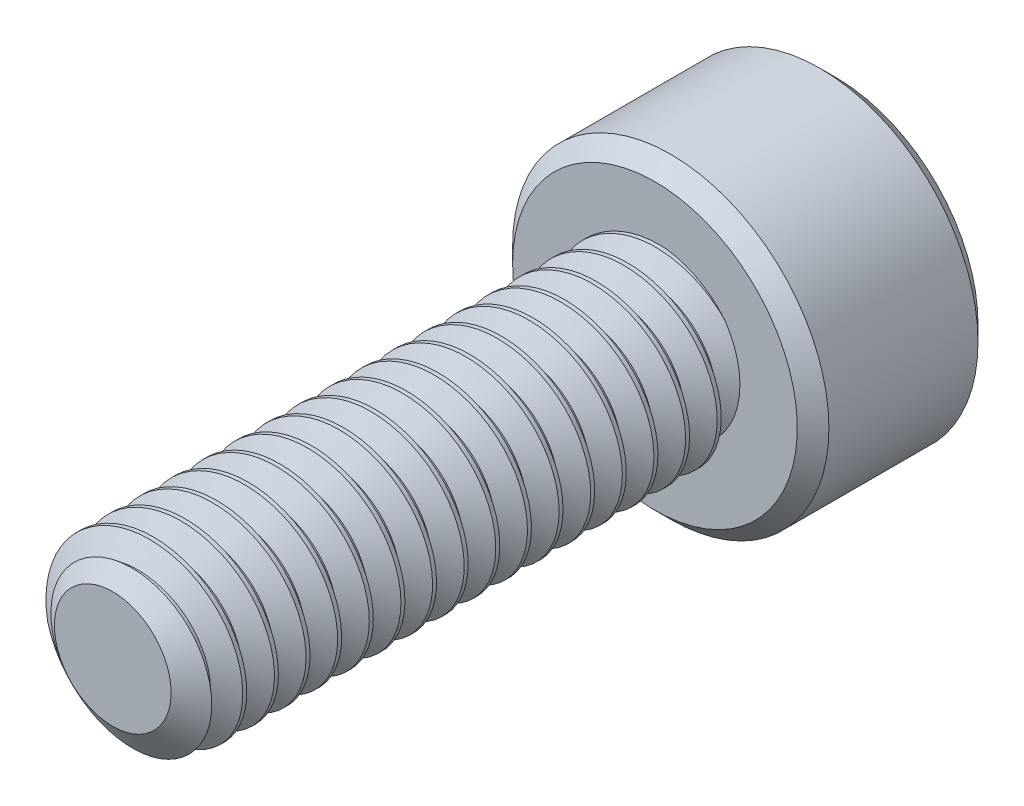
from build123d import *

# Parameters (mm, degrees)
SKETCH1_R          = 2
EXTRUDE1_DEPTH     = 12
CUT_SWEEP1_PITCH   = 0.7
SKETCH6_R          = 3.5
EXTRUDE2_DEPTH     = 4
CUT_EXTRUDE1_DEPTH = 2.25
CHAMFER1_SIZE      = 0.35


with BuildPart() as part:
    # Sketch1 → Extrude1 (new body)
    with BuildSketch(Plane.XY):
        Circle(SKETCH1_R)
    extrude(amount=-EXTRUDE1_DEPTH)

    # Cut-Sweep1: the profile of Sketch3 profile screwed along a right-hand helix of 18.142857 turns, 6 arcs to a turn; built about Z, then put on its axis
    cut_sweep1_z = Axis((0, 0, 0), (0, 0, 1))
    cut_sweep1_corners = [(2.0003, 0, -0.612673205), (1.545336663, 0, -0.35), (1.545336663, 0, -0.2625), (2.0003, 0, 0.000173205)]
    with BuildLine(mode=Mode.PRIVATE) as cut_sweep1_profile:
        Line(cut_sweep1_corners[0], cut_sweep1_corners[1])
        Line(cut_sweep1_corners[1], cut_sweep1_corners[2])
        Line(cut_sweep1_corners[2], cut_sweep1_corners[3])
        Line(cut_sweep1_corners[3], cut_sweep1_corners[0])
    cut_sweep1_cap = Face(cut_sweep1_profile.wire())
    cut_sweep1_turn_angles = [0, 30, 60, 90, 120, 150, 180, 210, 240, 270, 300, 330, 360]
    cut_sweep1_turn_weights = [1, 0.8660254037844387, 1, 0.8660254037844387, 1, 0.8660254037844387, 1, 0.8660254037844387, 1, 0.8660254037844387, 1, 0.8660254037844387, 1]
    cut_sweep1_turn_rails = [Edge.make_bspline([Vector(p[0], p[1], 0).rotate(cut_sweep1_z, cut_sweep1_turn_angles[k]) / cut_sweep1_turn_weights[k] + Vector(0, 0, p[2] + CUT_SWEEP1_PITCH * cut_sweep1_turn_angles[k] / 360) for k in range(13)], [0, 0, 0, 1, 1, 2, 2, 3, 3, 4, 4, 5, 5, 6, 6, 6], 2, cut_sweep1_turn_weights) for p in cut_sweep1_corners]
    cut_sweep1_turn_sides = [Face.make_surface_from_curves(cut_sweep1_turn_rails[p[0]], cut_sweep1_turn_rails[p[1]]) for p in [(0, 1), (1, 2), (2, 3), (3, 0)]]
    cut_sweep1_last_angles = [6480, 6505.714285714, 6531.428571429]
    cut_sweep1_last_weights = [1, 0.9009688679026391, 1]
    cut_sweep1_last_rails = [Edge.make_bspline([Vector(p[0], p[1], 0).rotate(cut_sweep1_z, cut_sweep1_last_angles[k]) / cut_sweep1_last_weights[k] + Vector(0, 0, p[2] + CUT_SWEEP1_PITCH * cut_sweep1_last_angles[k] / 360) for k in range(3)], [0, 0, 0, 1, 1, 1], 2, cut_sweep1_last_weights) for p in cut_sweep1_corners]
    cut_sweep1_last_sides = [Face.make_surface_from_curves(cut_sweep1_last_rails[p[0]], cut_sweep1_last_rails[p[1]]) for p in [(0, 1), (1, 2), (2, 3), (3, 0)]]
    cut_sweep1 = Plane(origin=(0, 0, 0), x_dir=(0, 1, 0), z_dir=(0, 0, -1)) * Solid(Shell([*[p.moved(Location((0, 0, CUT_SWEEP1_PITCH * i))) for i in range(18) for p in cut_sweep1_turn_sides], *cut_sweep1_last_sides, cut_sweep1_cap, cut_sweep1_cap.rotate(cut_sweep1_z, 6531.428571429).moved(Location((0, 0, CUT_SWEEP1_PITCH * 6531.428571429 / 360)))]))
    add(cut_sweep1, mode=Mode.SUBTRACT)

    # Sketch4 → Cut-Revolve1 (revolve, cut)
    with BuildSketch(Plane(origin=(0, 0, 0), x_dir=(0, 0, -1), z_dir=(1, 0, 0)), mode=Mode.PRIVATE) as cut_revolve1_sk:
        Polygon((0.496211411, 2), (0, 1.291336663), (0, 2), align=None)
    revolve(cut_revolve1_sk.sketch.rotate(Axis((0, 0, 0), (0, 0, -1)), 271.401126896), axis=Axis((0, 0, 0), (0, 0, -1)), mode=Mode.SUBTRACT)

    # Sketch6 → Extrude2 (add)
    with BuildSketch(Plane(origin=(0, 0, -12), x_dir=(-1, 0, 0), z_dir=(0, 0, -1))):
        Circle(SKETCH6_R)
    extrude(amount=EXTRUDE2_DEPTH)

    # Sketch7 → Cut-Extrude1 (cut)
    with BuildSketch(Plane(origin=(0, 0, -16), x_dir=(-1, 0, 0), z_dir=(0, 0, -1))):
        Polygon((0, 1.732050808), (-1.5, 0.866025404), (-1.5, -0.866025404), (0, -1.732050808), (1.5, -0.866025404), (1.5, 0.866025404), align=None)
    extrude(amount=-CUT_EXTRUDE1_DEPTH, mode=Mode.SUBTRACT)

    # Cut-Extrude2 cone 1 section (through the dimple's axis) → Cut-Extrude2 (revolve, cut)
    with BuildSketch(Plane(origin=(0, 0, -16), x_dir=(0, 1, 0), z_dir=(1, 0, 0))):
        Polygon((0, 0), (1.732050808, 0), (0, 1.732050808), align=None)
    revolve(axis=Axis((0, 0, -16), (0, 0, 1)), mode=Mode.SUBTRACT)

    # Chamfer1
    chamfer1_edges = [part.edges().sort_by_distance(p)[0] for p in [
        (3.5, 0, -12),
        (3.5, 0, -16),
    ]]
    chamfer(chamfer1_edges, length=CHAMFER1_SIZE)


solid = part.part
